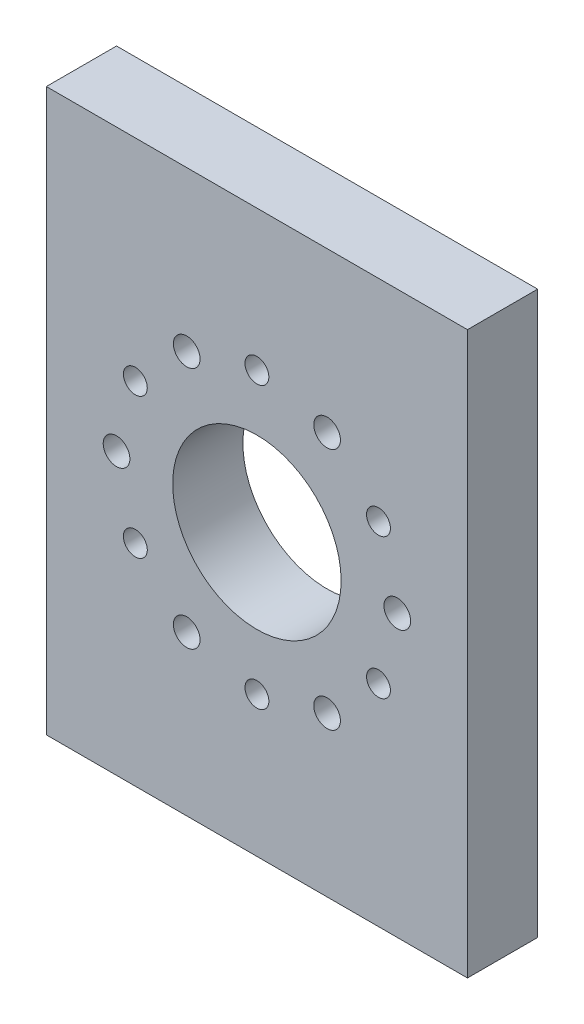
from build123d import *

# Parameters (mm, degrees)
SKETCH1_W              = 76.2
SKETCH1_H              = 101.6
SKETCH1_R              = 15.24
BOSS_EXTRUDE1_DEPTH    = 12.7
SKETCH2_R              = 2.413
SKETCH2_R_2            = 2.159
INITIAL_MOUNTING_DEPTH = 65.757547823
MOUNTING_PATTERN_COUNT = 6


with BuildPart() as part:
    # Sketch1 → Boss-Extrude1 (new body)
    with BuildSketch(Plane.XY):
        Rectangle(SKETCH1_W, SKETCH1_H)
        Circle(SKETCH1_R, mode=Mode.SUBTRACT)
    extrude(amount=BOSS_EXTRUDE1_DEPTH)

    # Sketch2 → Initial Mounting (cut, through all)
    with BuildSketch(Plane.XY.offset(12.7)):
        with Locations((-25.4, 0)):
            Circle(SKETCH2_R)
        with Locations((0, -25.4)):
            Circle(SKETCH2_R_2)
    initial_mounting = extrude(amount=-INITIAL_MOUNTING_DEPTH, mode=Mode.SUBTRACT)

    # Mounting Pattern: Initial Mounting ×6 about axis
    mounting_pattern_axis = Axis((0, 0, 12.7), (0, 0, 1))
    for i in range(1, MOUNTING_PATTERN_COUNT):
        add(initial_mounting.rotate(mounting_pattern_axis, i * 360 / MOUNTING_PATTERN_COUNT), mode=Mode.SUBTRACT)


solid = part.part
